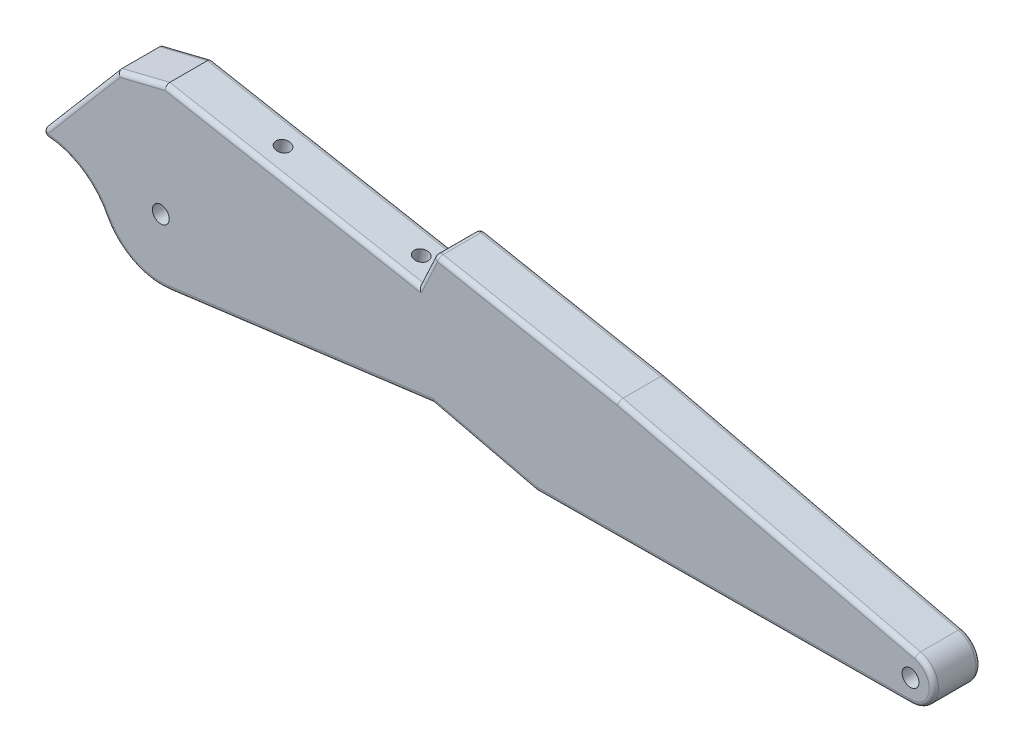
from build123d import *

# Parameters (mm, degrees)
SKETCH1_R           = 2.286
BOSS_EXTRUDE1_DEPTH = 12.7
FILLET1_R           = 1.27
SKETCH2_R           = 5.23875
CUT_EXTRUDE1_DEPTH  = 3.96875
SKETCH3_R           = 1.905
CUT_EXTRUDE2_DEPTH  = 12.7
SKETCH4_R           = 1.905
CUT_EXTRUDE3_DEPTH  = 12.7


with BuildPart() as part:
    # Sketch1 → Boss-Extrude1 (new body)
    with BuildSketch(Plane.XY):
        with BuildLine():
            Line((0.048604687, -6.34981398), (-101.551395313, -7.127511762))
            Line((-101.551395313, -7.127511762), (-129.54, -0.455968887))
            Line((-129.54, -0.455968887), (-200.976985186, -9.797318323))
            ThreePointArc((-200.976985186, -9.797318323), (-211.129033916, -7.99841015), (-218.413742395, -0.702302529))
            ThreePointArc((-218.413742395, -0.702302529), (-225.955701315, 7.104792041), (-236.5375, 9.525))
            Line((-236.5375, 9.525), (-214.9475, 34.925))
            Line((-214.9475, 34.925), (-202.035751798, 38.1))
            Line((-202.035751798, 38.1), (-133.35, 25.4))
            Line((-133.35, 25.4), (-128.905, 34.925))
            Line((-128.905, 34.925), (-79.17262462, 25.4))
            Line((-79.17262462, 25.4), (1.47237538, 6.17694186))
            ThreePointArc((1.47237538, 6.17694186), (6.309377787, -0.717113616), (0.048604687, -6.34981398))
        make_face()
        Circle(SKETCH1_R, mode=Mode.SUBTRACT)
        with Locations((-203.2, 7.20295315)):
            Circle(SKETCH1_R, mode=Mode.SUBTRACT)
    extrude(amount=BOSS_EXTRUDE1_DEPTH)

    # Fillet1
    fillet1_edges = [part.edges().sort_by_distance(p)[0] for p in [
        (-165.258492593, -5.126643605, 12.7),
        (-211.129033916, -7.99841015, 12.7),
        (-38.85012462, 15.78847093, 12.7),
        (-225.955701315, 7.104792041, 0),
        (-211.129033916, -7.99841015, 0),
        (-50.751395313, -6.738662871, 0),
        (-225.955701315, 7.104792041, 12.7),
        (-225.7425, 22.225, 12.7),
        (-208.491625899, 36.5125, 12.7),
        (-167.692875899, 31.75, 12.7),
        (-131.1275, 30.1625, 0),
        (-131.1275, 30.1625, 12.7),
        (-104.03881231, 30.1625, 12.7),
        (-115.545697656, -3.791740325, 12.7),
        (-50.751395313, -6.738662871, 12.7),
        (-208.491625899, 36.5125, 0),
        (-225.7425, 22.225, 0),
        (-167.692875899, 31.75, 0),
        (-128.905, 34.925, 6.35),
        (-165.258492593, -5.126643605, 0),
        (-115.545697656, -3.791740325, 0),
        (-38.85012462, 15.78847093, 0),
        (-104.03881231, 30.1625, 0),
        (6.309377787, -0.717113616, 12.7),
        (6.309377787, -0.717113616, 0),
        (-236.5375, 9.525, 6.35),
    ]]
    fillet(fillet1_edges, radius=FILLET1_R)

    # Sketch2 → Cut-Extrude1 (cut)
    with BuildSketch(Plane(origin=(0, 0, 0), x_dir=(-1, 0, 0), z_dir=(0, 0, -1))):
        Circle(SKETCH2_R)
    extrude(amount=-CUT_EXTRUDE1_DEPTH, mode=Mode.SUBTRACT)

    # Sketch3 → Cut-Extrude2 (cut)
    with BuildSketch(Plane(origin=(0.132942268, 0.718995244, 0), x_dir=(0.9833321660356336, -0.18181818181818188, 0), z_dir=(0.18181818181818188, 0.9833321660356336, 0))):
        with Locations((-179.556061292, -6.35)):
            Circle(SKETCH3_R)
        with Locations((-141.456061292, -6.35)):
            Circle(SKETCH3_R)
    extrude(amount=-CUT_EXTRUDE2_DEPTH, mode=Mode.SUBTRACT)

    # Sketch4 → Cut-Extrude3 (cut)
    with BuildSketch(Plane(origin=(-142.022496372, 120.719121916, 0), x_dir=(0, 0, 1), z_dir=(-0.7619393177594593, 0.6476484200955407, 0))):
        with Locations((6.35, -138.13201176)):
            Circle(SKETCH4_R)
    extrude(amount=-CUT_EXTRUDE3_DEPTH, mode=Mode.SUBTRACT)


solid = part.part
